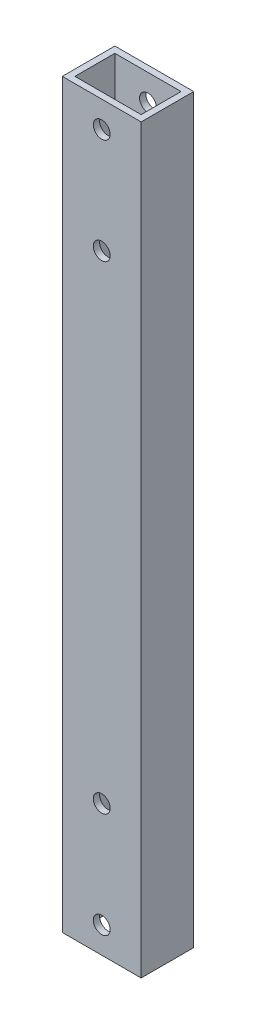
from build123d import *

# Parameters (mm, degrees)
SKETCH_1_W          = 15
SKETCH_1_H          = 10
SKETCH_1_W_2        = 12.6
SKETCH_1_H_2        = 7.6
EXTRUDE_1_DEPTH     = 70.5
SKETCH_2_R          = 1.6
CUT_EXTRUDE_1_DEPTH = 100


with BuildPart() as part:
    # ｽｹｯﾁ1 → ﾎﾞｽ - 押し出し1 (new, symmetric)
    with BuildSketch(Plane(origin=(0, 0, 0), x_dir=(1, 0, 0), z_dir=(0, 1, 0))):
        Rectangle(SKETCH_1_W, SKETCH_1_H)
        Rectangle(SKETCH_1_W_2, SKETCH_1_H_2, mode=Mode.SUBTRACT)
    extrude(amount=EXTRUDE_1_DEPTH, both=True)

    # ｽｹｯﾁ2 → ｶｯﾄ - 押し出し1 (cut)
    with BuildSketch(Plane(origin=(0, 0, -5), x_dir=(-1, 0, 0), z_dir=(0, 0, -1))):
        with Locations((0, -65.5)):
            Circle(SKETCH_2_R)
        with Locations((0, -45.5)):
            Circle(SKETCH_2_R)
        with Locations((0, 45.5)):
            Circle(SKETCH_2_R)
        with Locations((0, 65.5)):
            Circle(SKETCH_2_R)
    extrude(amount=-CUT_EXTRUDE_1_DEPTH, mode=Mode.SUBTRACT)


solid = part.part
